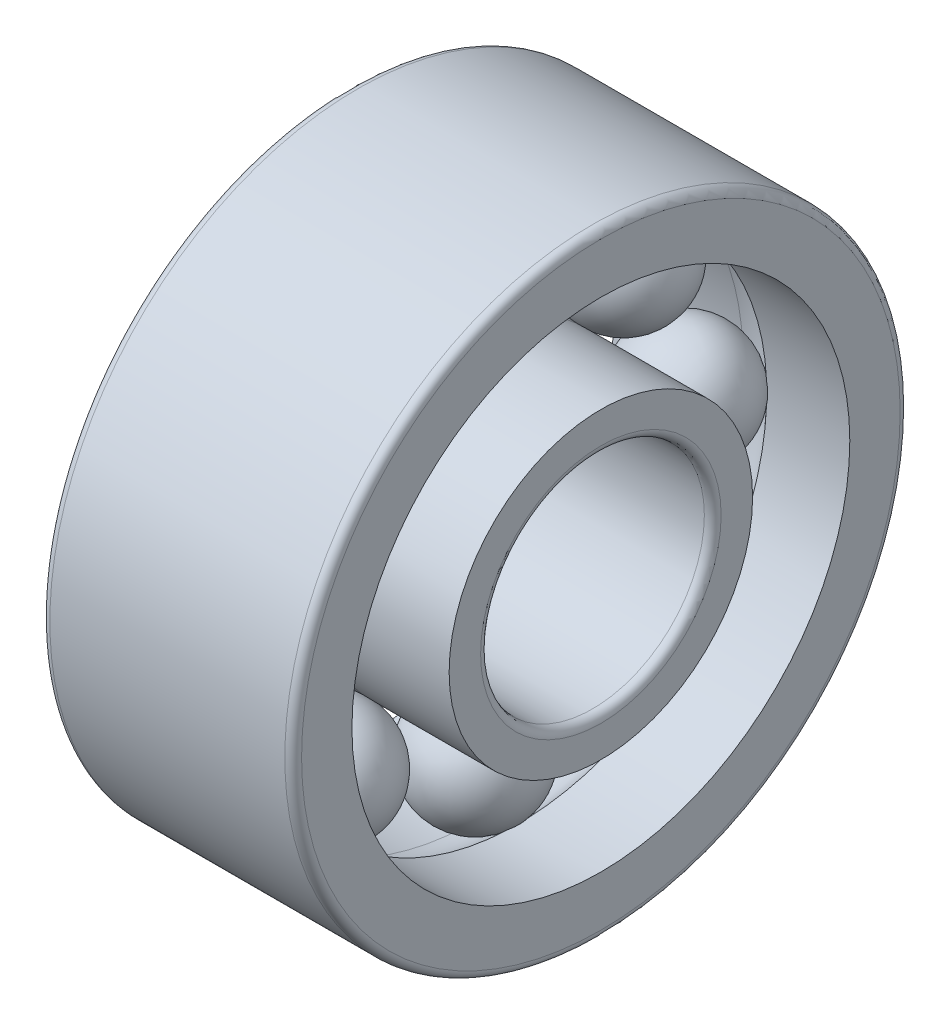
from build123d import *

# Parameters (mm, degrees)
CAGSPISKE_W         = 1.05
CAGSPISKE_H         = 0.7
CAGESPINE_ANGLE     = 0.001
BALLSDETAILED_COUNT = 8
BALLSDETAILED_ANGLE = 315


with BuildPart() as part:
    # CagSpiSke → CageSpine (revolve)
    with BuildSketch(Plane.XY):
        with Locations((0, 7.5)):
            Rectangle(CAGSPISKE_W, CAGSPISKE_H)
    revolve(axis=Axis((-20.6375, 0, 0), (1, 0, 0)), revolution_arc=CAGESPINE_ANGLE)

    # BalDetSke → BallDetailed (revolve)
    with BuildSketch(Plane.XY):
        with BuildLine():
            Line((-2.1, 7.5), (2.1, 7.5))
            ThreePointArc((2.1, 7.5), (0, 5.4), (-2.1, 7.5))
        make_face()
    balldetailed = revolve(axis=Axis((-1.905, 7.5, 0), (1, 0, 0)))

    # InnRacSke → InnerRace (revolve)
    with BuildSketch(Plane.XY):
        with BuildLine():
            Line((-1.531543339, 6.1), (-4.5, 6.1))
            Line((-4.5, 6.1), (-4.5, 4.3))
            ThreePointArc((-4.5, 4.3), (-4.412132034, 4.087867966), (-4.2, 4))
            Line((-4.2, 4), (4.2, 4))
            ThreePointArc((4.2, 4), (4.412132034, 4.087867966), (4.5, 4.3))
            Line((4.5, 4.3), (4.5, 5.425))
            Line((4.5, 5.425), (0, 5.425))
            ThreePointArc((0, 5.425), (-0.83684676, 5.601233953), (-1.531543339, 6.1))
        make_face()
    revolve(axis=Axis((-20.6375, 0, 0), (1, 0, 0)))

    # OutRacSke → OuterRace (revolve)
    with BuildSketch(Plane.XY):
        with BuildLine():
            Line((0, 9.575), (-4.5, 9.575))
            Line((-4.5, 9.575), (-4.5, 10.7))
            ThreePointArc((-4.5, 10.7), (-4.412132034, 10.912132034), (-4.2, 11))
            Line((-4.2, 11), (4.2, 11))
            ThreePointArc((4.2, 11), (4.412132034, 10.912132034), (4.5, 10.7))
            Line((4.5, 10.7), (4.5, 8.9))
            Line((4.5, 8.9), (1.531543339, 8.9))
            ThreePointArc((1.531543339, 8.9), (0.83684676, 9.398766047), (0, 9.575))
        make_face()
    revolve(axis=Axis((-20.6375, 0, 0), (1, 0, 0)))

    # BallsDetailed: BallDetailed ×8 about axis
    ballsdetailed_axis = Axis((-50, 0, 0), (1, 0, 0))
    for i in range(1, BALLSDETAILED_COUNT):
        add(balldetailed.rotate(ballsdetailed_axis, i * BALLSDETAILED_ANGLE / (BALLSDETAILED_COUNT - 1)))


solid = part.part
